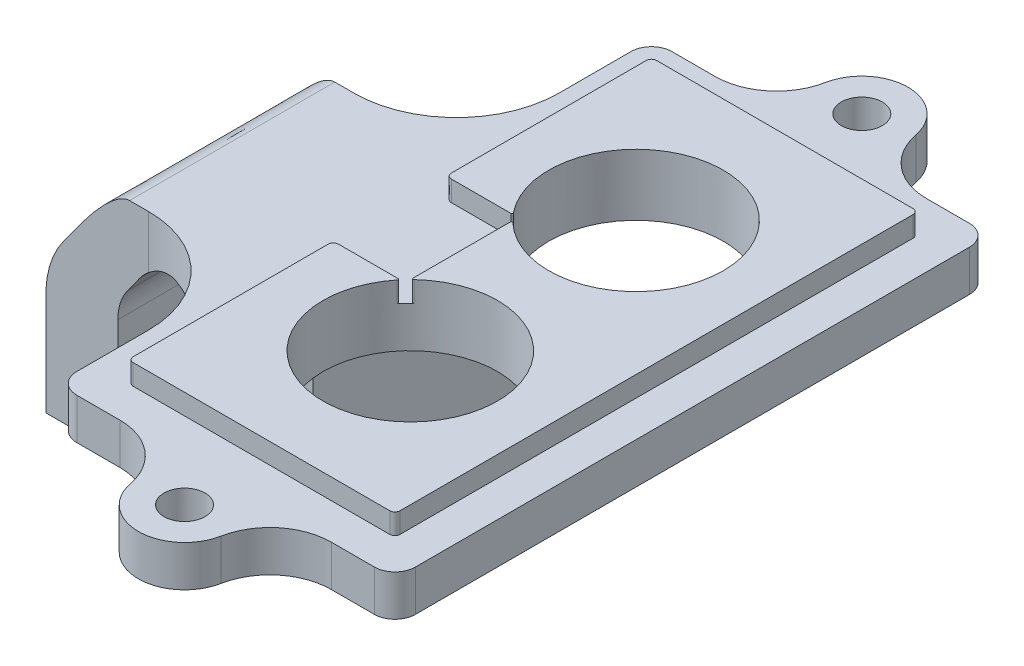
from build123d import *

# Parameters (mm, degrees)
BOSS_EXTRU_1_DEPTH      = 58
ESQUISSE16_R            = 2
BOSS_EXTRU_2_DEPTH      = 4
ESQUISSE9_R             = 2
ENL_V_MAT_EXTRU_5_DEPTH = 10
ESQUISSE14_W            = 20
ESQUISSE14_H            = 19
ENL_V_MAT_EXTRU_7_DEPTH = 84.798866341
ESQUISSE5_W             = 3.5
ESQUISSE5_H             = 7.5
ENL_V_MAT_EXTRU_3_DEPTH = 12
CONG_6_R                = 2
CONG_11_R               = 10
ESQUISSE15_W            = 72.69818271
ESQUISSE15_H            = 50
ENL_V_MAT_EXTRU_8_DEPTH = 18
ESQUISSE17_R            = 8.5
ENL_V_MAT_EXTRU_9_DEPTH = 10
CHANFREIN1_SIZE         = 9
CHANFREIN1_SIZE2        = 6.538882752
CHANFREIN2_SIZE         = 5
CHANFREIN2_SIZE2        = 3.63271264
CONG_14_R               = 5
CONG_16_START           = 18
CONG_16_DEPTH           = 22
BOSS_EXTRU_3_START      = 2
BOSS_EXTRU_3_DEPTH      = 2
CONG_17_START           = 22
CONG_17_DEPTH           = 3


with BuildPart() as part:
    # Esquisse1 → Boss.-Extru.1 (new body)
    with BuildSketch(Plane.XY):
        Polygon((0, 0), (0, 18), (15, 18), (15, 0), (19, 0), (19, 18), (46, 18), (46, 22), (-7, 22), (-7, 0), align=None)
    extrude(amount=BOSS_EXTRU_1_DEPTH)

    # Esquisse16 → Boss.-Extru.2 (add)
    # profile 1 of 2: a face of its own
    with BuildSketch(Plane(origin=(0, 22, 0), x_dir=(1, 0, 0), z_dir=(0, 1, 0))):
        with BuildLine():
            Line((17, -3), (42, -3))
            Line((42, -3), (42, 0))
            Line((42, 0), (39.807764064, 0))
            ThreePointArc((39.807764064, 0), (35.990510002, 1.370899501), (33.91761317, 4.857142857))
            ThreePointArc((33.91761317, 4.857142857), (29.5, 8.5), (25.08238683, 4.857142857))
            ThreePointArc((25.08238683, 4.857142857), (23.009489998, 1.370899501), (19.192235936, 0))
            Line((19.192235936, 0), (17, 0))
            Line((17, 0), (17, -3))
        make_face()
        with Locations(Location((29.5, 4, 0), (0, 0, 270))):
            Circle(ESQUISSE16_R, mode=Mode.SUBTRACT)
    # profile 2 of 2: a face of its own
    with BuildSketch(Plane(origin=(0, 22, 0), x_dir=(1, 0, 0), z_dir=(0, 1, 0))):
        with BuildLine():
            Line((17, -58), (17, -55))
            Line((17, -55), (42, -55))
            Line((42, -55), (42, -58))
            Line((42, -58), (39.807764064, -58))
            ThreePointArc((39.807764064, -58), (35.990510002, -59.370899501), (33.91761317, -62.857142857))
            ThreePointArc((33.91761317, -62.857142857), (29.5, -66.5), (25.08238683, -62.857142857))
            ThreePointArc((25.08238683, -62.857142857), (23.009489998, -59.370899501), (19.192235936, -58))
            Line((19.192235936, -58), (17, -58))
        make_face()
        with Locations(Location((29.5, -62, 0), (0, 0, 270))):
            Circle(ESQUISSE16_R, mode=Mode.SUBTRACT)
    extrude(amount=-BOSS_EXTRU_2_DEPTH)

    # Esquisse9 → Enlèv. mat.-Extru.5 (cut)
    with BuildSketch(Plane.ZY.offset(7)):
        with Locations(Location((33.5, 7, 0), (0, 0, 270))):
            Circle(ESQUISSE9_R)
        with Locations(Location((24.5, 7, 0), (0, 0, 270))):
            Circle(ESQUISSE9_R)
    extrude(amount=-ENL_V_MAT_EXTRU_5_DEPTH, mode=Mode.SUBTRACT)

    # Esquisse14 → Enlèv. mat.-Extru.7 (cut, through all)
    with BuildSketch(Plane(origin=(0, 22, 0), x_dir=(1, 0, 0), z_dir=(0, 1, 0))):
        with Locations((3, -9.5)):
            Rectangle(ESQUISSE14_W, ESQUISSE14_H)
        with Locations((3, -48.5)):
            Rectangle(ESQUISSE14_W, ESQUISSE14_H)
    extrude(amount=-ENL_V_MAT_EXTRU_7_DEPTH, mode=Mode.SUBTRACT)

    # Esquisse5 → Enlèv. mat.-Extru.3 (cut)
    with BuildSketch(Plane.XZ):
        with Locations((-3.5, 33.5)):
            Rectangle(ESQUISSE5_W, ESQUISSE5_H)
        with Locations((-3.5, 24.5)):
            Rectangle(ESQUISSE5_W, ESQUISSE5_H)
    extrude(amount=-ENL_V_MAT_EXTRU_3_DEPTH, mode=Mode.SUBTRACT)

    # Congé6
    cong_6_edges = [part.edges().sort_by_distance(p)[0] for p in [
        (46, 20, 0),
        (46, 20, 58),
        (13, 20, 0),
        (13, 20, 58),
    ]]
    fillet(cong_6_edges, radius=CONG_6_R)

    # Congé11
    cong_11_edges = [part.edges().sort_by_distance(p)[0] for p in [
        (13, 20, 19),
        (13, 20, 39),
    ]]
    fillet(cong_11_edges, radius=CONG_11_R)

    # Esquisse15 → Enlèv. mat.-Extru.8 (cut)
    with BuildSketch(Plane.XZ):
        with Locations((29.349091355, -6)):
            Rectangle(ESQUISSE15_W, ESQUISSE15_H)
        with Locations((29.349091355, 64)):
            Rectangle(ESQUISSE15_W, ESQUISSE15_H)
    extrude(amount=-ENL_V_MAT_EXTRU_8_DEPTH, mode=Mode.SUBTRACT)

    # Esquisse17 → Enlèv. mat.-Extru.9 (cut)
    with BuildSketch(Plane(origin=(0, 22, 0), x_dir=(1, 0, 0), z_dir=(0, 1, 0))):
        with Locations(Location((29.5, -18, 0), (0, 0, 270))):
            Circle(ESQUISSE17_R)
        with Locations(Location((29.5, -40, 0), (0, 0, 270))):
            Circle(ESQUISSE17_R)
    extrude(amount=-ENL_V_MAT_EXTRU_9_DEPTH, mode=Mode.SUBTRACT)

    # Chanfrein1
    chanfrein1_edges = [part.edges().sort_by_distance(p)[0] for p in [
        (-7, 22, 29),
    ]]
    chanfrein1_side = [part.faces().sort_by_distance(p)[0] for p in [
        (-7, 11.242320797, 29),
    ]]
    chamfer(chanfrein1_edges, length=CHANFREIN1_SIZE, length2=CHANFREIN1_SIZE2, reference=chanfrein1_side[0])

    # Chanfrein2
    chanfrein2_edges = [part.edges().sort_by_distance(p)[0] for p in [
        (0, 18, 29),
    ]]
    chanfrein2_side = [part.faces().sort_by_distance(p)[0] for p in [
        (0, 9.150105695, 29),
    ]]
    chamfer(chanfrein2_edges, length=CHANFREIN2_SIZE, length2=CHANFREIN2_SIZE2, reference=chanfrein2_side[0])

    # Congé14
    cong_14_edges = [part.edges().sort_by_distance(p)[0] for p in [
        (3.63271264, 18, 29),
        (0, 13, 29),
    ]]
    fillet(cong_14_edges, radius=CONG_14_R)

    # Congé15
    # a fillet whose section is not a circle: 8, 6 mm, written as the material it takes off along each edge
    with BuildSketch(Plane(origin=(-0.461117248, 22, 5.17677837), x_dir=(1, 0, 0), z_dir=(0, 0, 1))) as cong_15_piece_1:
        with BuildLine():
            Bezier((1.604067641, 0), (0, 0), (-3.250034325, -4.473288486), weights=[1, 0.891006524, 1])
            Line((-3.250034325, -4.473288486), (0, 0))
            Line((0, 0), (1.604067641, 0))
        make_face()
    extrude(amount=47.64644326, mode=Mode.SUBTRACT)

    # Congé16: read off the stored shape, not the designer's step
    # Congé16 outline → Congé16 (cut)
    with BuildSketch(Plane.XY.offset(CONG_16_START)):
        with BuildLine():
            Line((-7, 13), (-7, 10.075722734))
            add(Edge.make_bspline(
                [(-7, 10.075722734), (-7, 13), (-5.281152949, 15.365790005)],
                knots=[0, 0, 0, 1, 1, 1], degree=2, weights=[1, 0.951056516, 1]))
            Line((-5.281152949, 15.365790005), (-7, 13))
        make_face()
    extrude(amount=CONG_16_DEPTH, mode=Mode.SUBTRACT)

    # Esquisse19 → Boss.-Extru.3 (add)
    with BuildSketch(Plane(origin=(0, 22, 0), x_dir=(1, 0, 0), z_dir=(0, 1, 0)).offset(BOSS_EXTRU_3_START)):
        with BuildLine():
            ThreePointArc((38, -18), (32.759601203, -25.850159234), (23.5, -24.020797289))
            Line((23.5, -24.020797289), (23.5, -33.979202711))
            ThreePointArc((23.5, -33.979202711), (32.759601203, -32.149840766), (38, -40))
            ThreePointArc((38, -40), (26.570520177, -47.979232292), (23.019259302, -34.5))
            Line((23.019259302, -34.5), (17, -34.5))
            ThreePointArc((17, -34.5), (16.646446609, -34.646446609), (16.5, -35))
            Line((16.5, -35), (16.5, -54))
            ThreePointArc((16.5, -54), (16.646446609, -54.353553391), (17, -54.5))
            Line((17, -54.5), (42, -54.5))
            ThreePointArc((42, -54.5), (42.353553391, -54.353553391), (42.5, -54))
            Line((42.5, -54), (42.5, -4))
            ThreePointArc((42.5, -4), (42.353553391, -3.646446609), (42, -3.5))
            Line((42, -3.5), (17, -3.5))
            ThreePointArc((17, -3.5), (16.646446609, -3.646446609), (16.5, -4))
            Line((16.5, -4), (16.5, -23))
            ThreePointArc((16.5, -23), (16.646446609, -23.353553391), (17, -23.5))
            Line((17, -23.5), (23.019259302, -23.5))
            ThreePointArc((23.019259302, -23.5), (26.570520177, -10.020767708), (38, -18))
        make_face()
    extrude(amount=-BOSS_EXTRU_3_DEPTH)

    # Congé17: read off the stored shape, not the designer's step
    # Congé17 outline → Congé17 (cut)
    with BuildSketch(Plane(origin=(0, 0, 0), x_dir=(1, 0, 0), z_dir=(0, 1, 0)).offset(CONG_17_START)):
        with BuildLine():
            ThreePointArc((23.668604651, -33.815759684), (23.560379709, -33.834820214), (23.5, -33.743003916))
            Line((23.5, -33.743003916), (23.5, -33.979202711))
            ThreePointArc((23.5, -33.979202711), (23.583737888, -33.896898934), (23.668604651, -33.815759684))
        make_face()
        with BuildLine():
            ThreePointArc((22.884548627, -23.337209302), (22.896939159, -23.443133109), (22.806719788, -23.5))
            Line((22.806719788, -23.5), (23.019259302, -23.5))
            ThreePointArc((23.019259302, -23.5), (22.951398096, -23.419023261), (22.884548627, -23.337209302))
        make_face()
        with BuildLine():
            ThreePointArc((23.668604651, -24.184240316), (23.583737888, -24.103101066), (23.5, -24.020797289))
            Line((23.5, -24.020797289), (23.5, -24.256996084))
            ThreePointArc((23.5, -24.256996084), (23.560379709, -24.165179786), (23.668604651, -24.184240316))
        make_face()
        with BuildLine():
            ThreePointArc((22.884548627, -34.662790698), (22.951398096, -34.580976739), (23.019259302, -34.5))
            Line((23.019259302, -34.5), (22.806719788, -34.5))
            ThreePointArc((22.806719788, -34.5), (22.896939159, -34.556866891), (22.884548627, -34.662790698))
        make_face()
    extrude(amount=CONG_17_DEPTH, mode=Mode.SUBTRACT)


solid = part.part
